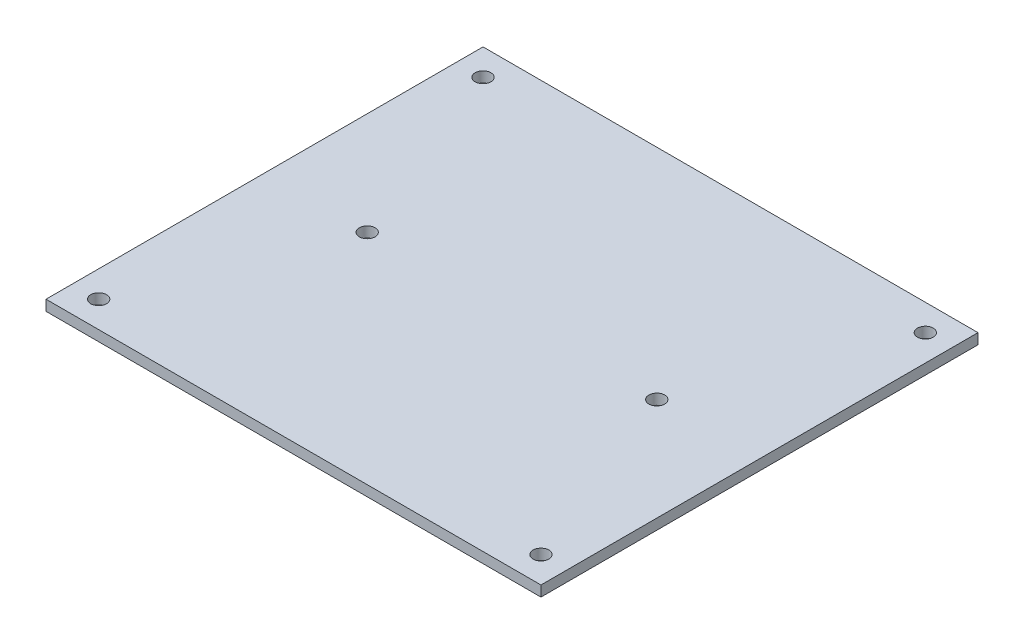
from build123d import *

# Parameters (mm, degrees)
SKETCH1_W           = 94
SKETCH1_H           = 83
SKETCH1_R           = 1.5
BOSS_EXTRUDE1_DEPTH = 2
SKETCH2_R           = 1.5
CUT_EXTRUDE1_DEPTH  = 63.731570999


with BuildPart() as part:
    # Sketch1 → Boss-Extrude1 (new body)
    with BuildSketch(Plane(origin=(0, 0, 0), x_dir=(1, 0, 0), z_dir=(0, 1, 0))):
        Rectangle(SKETCH1_W, SKETCH1_H)
        with Locations((-42, 36.5)):
            Circle(SKETCH1_R, mode=Mode.SUBTRACT)
        with Locations((42, 36.5)):
            Circle(SKETCH1_R, mode=Mode.SUBTRACT)
        with Locations((42, -36.5)):
            Circle(SKETCH1_R, mode=Mode.SUBTRACT)
        with Locations((-42, -36.5)):
            Circle(SKETCH1_R, mode=Mode.SUBTRACT)
    extrude(amount=BOSS_EXTRUDE1_DEPTH)

    # Sketch2 → Cut-Extrude1 (cut, through all)
    with BuildSketch(Plane(origin=(0, 2, 0), x_dir=(1, 0, 0), z_dir=(0, 1, 0))):
        with Locations((27.5, 0)):
            Circle(SKETCH2_R)
        with Locations((-27.5, 0)):
            Circle(SKETCH2_R)
    extrude(amount=-CUT_EXTRUDE1_DEPTH, mode=Mode.SUBTRACT)


solid = part.part
